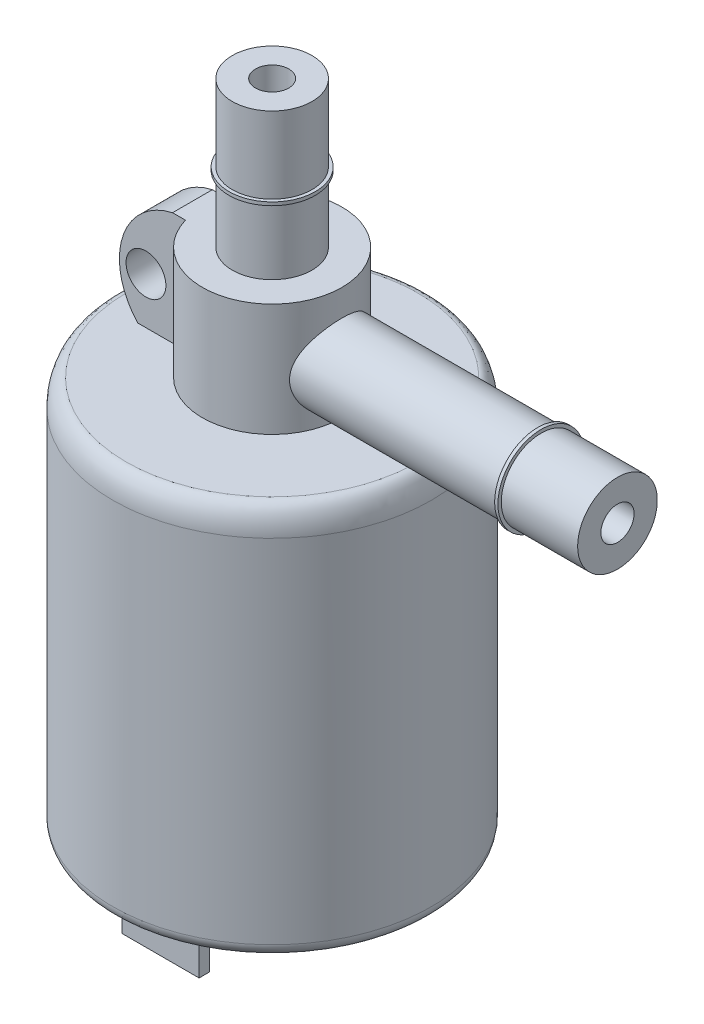
from build123d import *

# Parameters (mm, degrees)
ESQUISSE2_R        = 1.5
BOSS_EXTRU_1_DEPTH = 1.5
ESQUISSE4_R        = 5
ESQUISSE4_W        = 8.5
ESQUISSE4_H        = 2.5
BOSS_EXTRU_2_DEPTH = 0.5
ESQUISSE5_W        = 5.8
ESQUISSE5_H        = 0.8
BOSS_EXTRU_3_DEPTH = 4
CONG_2_SIZE        = 2
CONG_2_SIZE_2      = 1
CONG_3_R           = 1


with BuildPart() as part:
    # Esquisse1 → Révolution1 (revolve)
    with BuildSketch(Plane.XY, mode=Mode.PRIVATE) as r_volution1_sk:
        Polygon((0, 0), (12, 0), (12, 29.5), (5.25, 29.5), (5.25, 38), (3, 38), (3, 43), (3.25, 43), (3.25, 43.25), (3, 43.25), (3, 49), (1.25, 49), (1.25, 38), (0, 38), align=None)
    revolve(r_volution1_sk.sketch.rotate(Axis((0, 0, 0), (0, -1, 0)), 180), axis=Axis((0, 0, 0), (0, -1, 0)))

    # Esquisse2 → Boss.-Extru.1 (add, symmetric)
    with BuildSketch(Plane.XY):
        with BuildLine():
            Line((0, 38), (-6, 38))
            ThreePointArc((-6, 38), (-10, 33), (-6, 28))
            Line((-6, 28), (0, 28))
            Line((0, 28), (0, 38))
        make_face()
        with Locations((-8, 33)):
            Circle(ESQUISSE2_R, mode=Mode.SUBTRACT)
    extrude(amount=BOSS_EXTRU_1_DEPTH, both=True)

    # Esquisse3 → Révolution3 (revolve)
    with BuildSketch(Plane.XY, mode=Mode.PRIVATE) as r_volution3_sk:
        Polygon((0, 36), (20, 36), (20, 36.25), (20.25, 36.25), (20.25, 36), (26, 36), (26, 34.25), (15, 34.25), (15, 33), (0, 33), align=None)
    revolve(r_volution3_sk.sketch.rotate(Axis((15, 33, 0), (1, 0, 0)), 90), axis=Axis((15, 33, 0), (1, 0, 0)))

    # Esquisse4 → Boss.-Extru.2 (add)
    with BuildSketch(Plane.XZ):
        with Locations(Location((0, 0, 0), (0, 0, 180))):
            Circle(ESQUISSE4_R)
        with Locations((0, 8)):
            Rectangle(ESQUISSE4_W, ESQUISSE4_H)
        with Locations((0, -8)):
            Rectangle(ESQUISSE4_W, ESQUISSE4_H)
    extrude(amount=BOSS_EXTRU_2_DEPTH)

    # Esquisse5 → Boss.-Extru.3 (add)
    with BuildSketch(Plane.XZ):
        with Locations((0, 8)):
            Rectangle(ESQUISSE5_W, ESQUISSE5_H)
        with Locations((0, -8)):
            Rectangle(ESQUISSE5_W, ESQUISSE5_H)
    extrude(amount=BOSS_EXTRU_3_DEPTH)

    # Congé2
    # an asymmetric fillet: 2, 1 mm, written as the material it takes off along each edge
    with BuildSketch(Plane(origin=(0, 29.5, 0), x_dir=(-1, 0, 0), z_dir=(0, 0, 1))) as cong_2_piece_1:
        with BuildLine():
            Bezier((12, CONG_2_SIZE), (12, 0), (12 - CONG_2_SIZE_2, 0), weights=[1, 0.707106781, 1])
            Line((12 - CONG_2_SIZE_2, 0), (12, 0))
            Line((12, 0), (12, CONG_2_SIZE))
        make_face()
    revolve(axis=Axis((0, 29.5, 0), (0, -1, 0)), mode=Mode.SUBTRACT)

    # Congé3
    cong_3_edges = [part.edges().sort_by_distance(p)[0] for p in [
        (12, 0, 0),
    ]]
    fillet(cong_3_edges, radius=CONG_3_R)


solid = part.part
